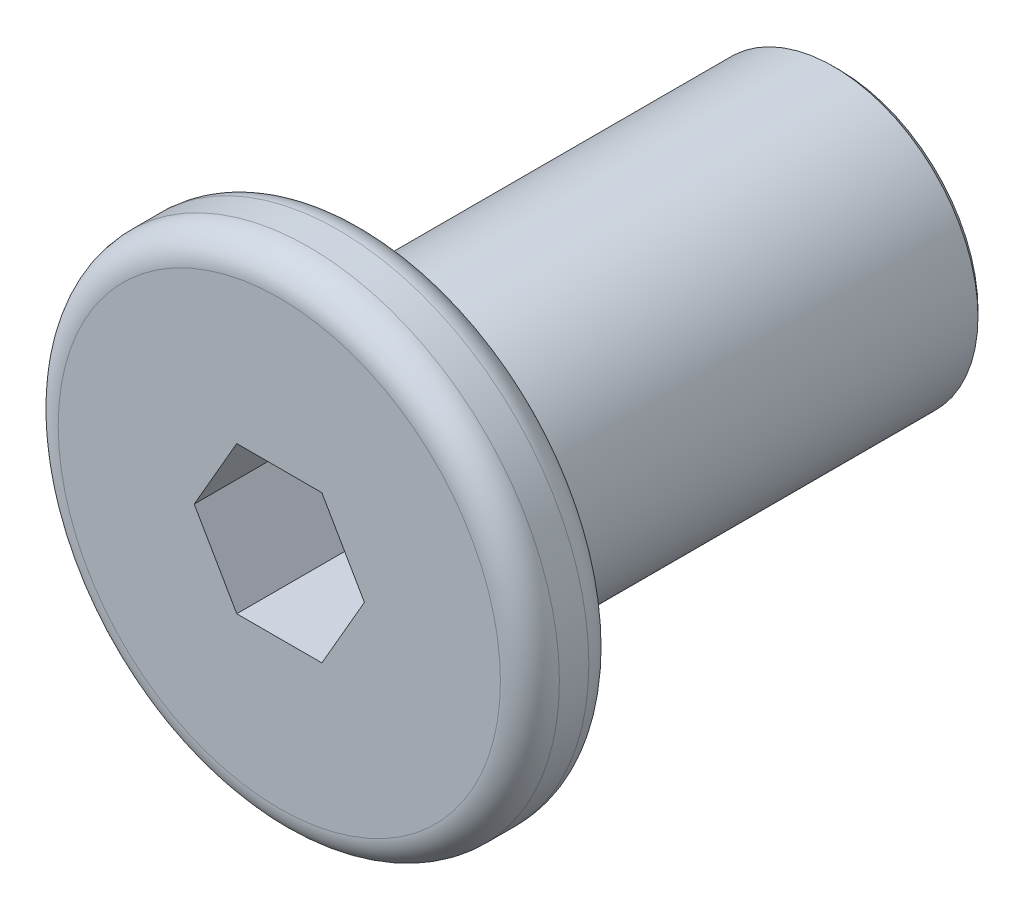
from build123d import *

# Parameters (mm, degrees)
SKETCH_1_R                      = 4.25
EXTRUDE_1_DEPTH                 = 1.5
SKETCH_2_R                      = 2.45
EXTRUDE_2_DEPTH                 = 8
FILLET_1_R                      = 0.5
CUT_EXTRUDE_1_DEPTH             = 2
SKIZZE2_R                       = 1.65
SCHNITT_LINEAR_AUSTRAGEN1_DEPTH = 7
GEWINDE2_PITCH                  = 0.7
FASE2_SIZE                      = 0.1


with BuildPart() as part:
    # Эскиз1 → Бобышка-Вытянуть1 (new body)
    with BuildSketch(Plane.XY):
        Circle(SKETCH_1_R)
    extrude(amount=EXTRUDE_1_DEPTH)

    # Эскиз2 → Бобышка-Вытянуть2 (add)
    with BuildSketch(Plane(origin=(0, 0, 0), x_dir=(-1, 0, 0), z_dir=(0, 0, -1))):
        Circle(SKETCH_2_R)
    extrude(amount=EXTRUDE_2_DEPTH)

    # Скругление1
    fillet_1_edges = [part.edges().sort_by_distance(p)[0] for p in [
        (-4.25, 0, 0),
        (-4.25, 0, 1.5),
    ]]
    fillet(fillet_1_edges, radius=FILLET_1_R)

    # Эскиз3 → Вырез-Вытянуть1 (cut)
    with BuildSketch(Plane.XY.offset(1.5)):
        Polygon((1.443375673, 0), (0.721687836, 1.25), (-0.721687836, 1.25), (-1.443375673, 0), (-0.721687836, -1.25), (0.721687836, -1.25), align=None)
    extrude(amount=-CUT_EXTRUDE_1_DEPTH, mode=Mode.SUBTRACT)

    # Skizze2 → Schnitt-Linear austragen1 (cut)
    with BuildSketch(Plane(origin=(0, 0, -8), x_dir=(-1, 0, 0), z_dir=(0, 0, -1))):
        Circle(SKIZZE2_R)
    extrude(amount=-SCHNITT_LINEAR_AUSTRAGEN1_DEPTH, mode=Mode.SUBTRACT)

    # Gewinde2: the profile of Gewindeprofil2 profile screwed along a right-hand helix of 11.428571 turns, 6 arcs to a turn; built about Z, then put on its axis
    gewinde2_z = Axis((0, 0, 0), (0, 0, 1))
    gewinde2_corners = [(1.6497, 0, -0.000173205), (2.028886112, 0, 0.218749999), (2.028886112, 0, 0.306249999), (1.6497, 0, 0.525173203)]
    with BuildLine(mode=Mode.PRIVATE) as gewinde2_profile:
        Line(gewinde2_corners[0], gewinde2_corners[1])
        Line(gewinde2_corners[1], gewinde2_corners[2])
        Line(gewinde2_corners[2], gewinde2_corners[3])
        Line(gewinde2_corners[3], gewinde2_corners[0])
    gewinde2_cap = Face(gewinde2_profile.wire())
    gewinde2_turn_angles = [0, 30, 60, 90, 120, 150, 180, 210, 240, 270, 300, 330, 360]
    gewinde2_turn_weights = [1, 0.8660254037844387, 1, 0.8660254037844387, 1, 0.8660254037844387, 1, 0.8660254037844387, 1, 0.8660254037844387, 1, 0.8660254037844387, 1]
    gewinde2_turn_rails = [Edge.make_bspline([Vector(p[0], p[1], 0).rotate(gewinde2_z, gewinde2_turn_angles[k]) / gewinde2_turn_weights[k] + Vector(0, 0, p[2] + GEWINDE2_PITCH * gewinde2_turn_angles[k] / 360) for k in range(13)], [0, 0, 0, 1, 1, 2, 2, 3, 3, 4, 4, 5, 5, 6, 6, 6], 2, gewinde2_turn_weights) for p in gewinde2_corners]
    gewinde2_turn_sides = [Face.make_surface_from_curves(gewinde2_turn_rails[p[0]], gewinde2_turn_rails[p[1]]) for p in [(0, 1), (1, 2), (2, 3), (3, 0)]]
    gewinde2_last_angles = [3960, 3990, 4020, 4050, 4080, 4097.142857143, 4114.285714286]
    gewinde2_last_weights = [1, 0.8660254037844387, 1, 0.8660254037844387, 1, 0.9555728057861397, 1]
    gewinde2_last_rails = [Edge.make_bspline([Vector(p[0], p[1], 0).rotate(gewinde2_z, gewinde2_last_angles[k]) / gewinde2_last_weights[k] + Vector(0, 0, p[2] + GEWINDE2_PITCH * gewinde2_last_angles[k] / 360) for k in range(7)], [0, 0, 0, 1, 1, 2, 2, 3, 3, 3], 2, gewinde2_last_weights) for p in gewinde2_corners]
    gewinde2_last_sides = [Face.make_surface_from_curves(gewinde2_last_rails[p[0]], gewinde2_last_rails[p[1]]) for p in [(0, 1), (1, 2), (2, 3), (3, 0)]]
    gewinde2 = Plane(origin=(0, 0, -9), x_dir=(1, 0, 0), z_dir=(0, 0, 1)) * Solid(Shell([*[p.moved(Location((0, 0, GEWINDE2_PITCH * i))) for i in range(11) for p in gewinde2_turn_sides], *gewinde2_last_sides, gewinde2_cap, gewinde2_cap.rotate(gewinde2_z, 4114.285714286).moved(Location((0, 0, GEWINDE2_PITCH * 4114.285714286 / 360)))]))
    add(gewinde2, mode=Mode.SUBTRACT)

    # Skizze7 → Schnitt-Rotation2 (revolve, cut)
    with BuildSketch(Plane(origin=(0, 0, 0), x_dir=(1, 0, 0), z_dir=(0, 1, 0)), mode=Mode.PRIVATE) as schnitt_rotation2_sk:
        Polygon((0, 8), (2.1, 8), (1.6, 7.5), (0, 7.5), align=None)
    revolve(schnitt_rotation2_sk.sketch.rotate(Axis((0, 0, -7.5), (0, 0, -1)), 244.623012136), axis=Axis((0, 0, -7.5), (0, 0, -1)), mode=Mode.SUBTRACT)

    # Fase2
    fase2_edges = [part.edges().sort_by_distance(p)[0] for p in [
        (2.45, 0, -8),
    ]]
    chamfer(fase2_edges, length=FASE2_SIZE)


solid = part.part
